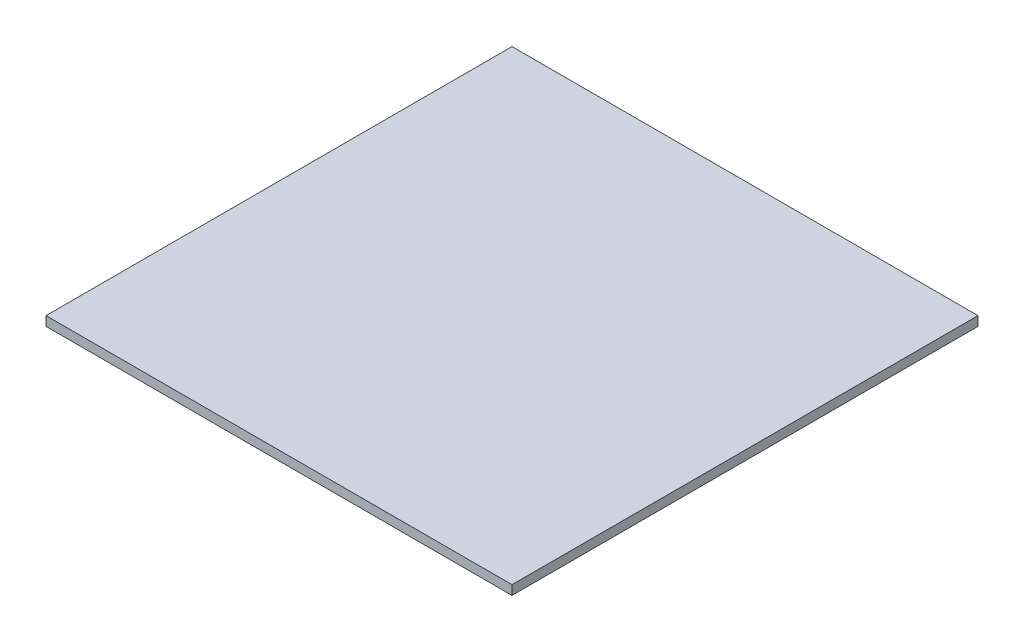
from build123d import *

# Parameters (mm, degrees)
SKETCH1_W           = 200
SKETCH1_H           = 200
BOSS_EXTRUDE1_DEPTH = 4
SKETCH2_W           = 192
SKETCH2_H           = 192
BOSS_EXTRUDE2_DEPTH = 4


with BuildPart() as part:
    # Sketch1 → Boss-Extrude1 (new body)
    with BuildSketch(Plane(origin=(0, 0, 0), x_dir=(1, 0, 0), z_dir=(0, 1, 0))):
        Rectangle(SKETCH1_W, SKETCH1_H)
    extrude(amount=BOSS_EXTRUDE1_DEPTH)

    # Sketch2 → Boss-Extrude2 (add)
    with BuildSketch(Plane(origin=(0, 0, 0), x_dir=(-1, 0, 0), z_dir=(0, -1, 0))):
        Rectangle(SKETCH2_W, SKETCH2_H)
    extrude(amount=BOSS_EXTRUDE2_DEPTH)


solid = part.part
